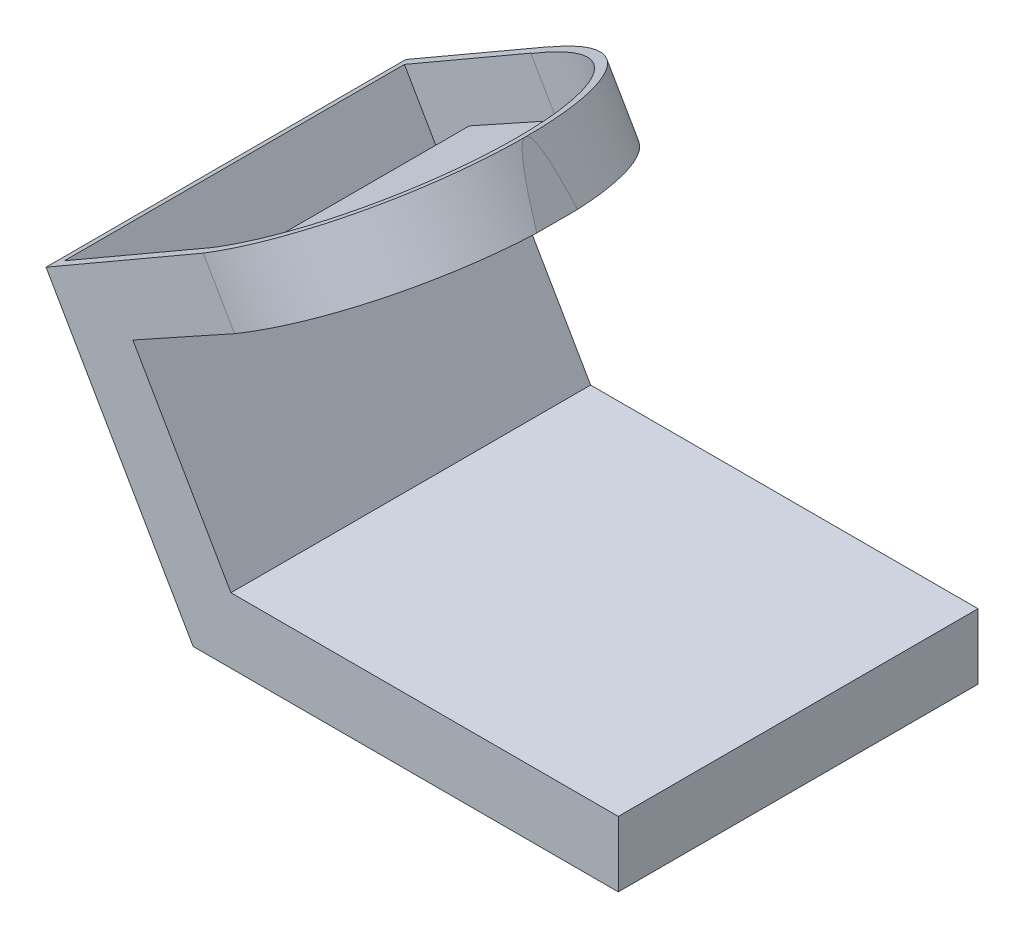
from build123d import *

# Parameters (mm, degrees)
SALIENTE_EXTRUIR1_DEPTH = 110
CORTAR_EXTRUIR9_DEPTH   = 55
VACIADO3_START          = 3.186974639
VACIADO3_DEPTH          = 103.813025361
VACIADO3_START_2        = 3
VACIADO3_2_DEPTH        = 0.273585229
VACIADO3_START_3        = -90
VACIADO3_3_DEPTH        = 16.944212752
CROQUIS7_R              = 9.5
CORTAR_EXTRUIR10_DEPTH  = 55


with BuildPart() as part:
    # Croquis1 → Saliente-Extruir1 (new body)
    with BuildSketch(Plane.XY):
        Polygon((0, 0), (130, 0), (130, 20), (11.547005384, 20), (-18.439456819, 71.938076074), (56.490425623, 113.447420953), (46.798692801, 130.942286341), (-45, 77.942286341), align=None)
    extrude(amount=SALIENTE_EXTRUIR1_DEPTH)

    # Croquis6 → Cortar-Extruir9 (cut, symmetric)
    with BuildSketch(Plane(origin=(-45, 77.942286341, 0), x_dir=(0.8660254037844362, 0.5000000000000044, 0), z_dir=(-0.5000000000000043, 0.866025403784436, 0))):
        with BuildLine():
            Line((51, -110.186974639), (51, -125.465118776))
            Line((51, -125.465118776), (118.324922333, -125.465118776))
            Line((118.324922333, -125.465118776), (118.324922333, 14.437296871))
            Line((118.324922333, 14.437296871), (51, 14.437296871))
            Line((51, 14.437296871), (51, -0.186974639))
            ThreePointArc((51, -0.186974639), (106, -55.186974639), (51, -110.186974639))
        make_face()
    extrude(amount=CORTAR_EXTRUIR9_DEPTH, both=True, mode=Mode.SUBTRACT)

    # Vaciado3: read off the stored shape, not the designer's step
    # Vaciado3 outline → Vaciado3 (cut)
    with BuildSketch(Plane.XY.offset(VACIADO3_START)):
        Polygon((52.412435892, 114.617890838), (44.200209183, 129.442051124), (-42.401923789, 79.442286341), (1.732050808, 3), (127, 3), (127, 17), (9.814954576, 17), (-22.564333351, 73.082571803), align=None)
    extrude(amount=VACIADO3_DEPTH, mode=Mode.SUBTRACT)

    # Vaciado3 2 outline → Vaciado3 2 (cut)
    with BuildSketch(Plane.XY.offset(VACIADO3_START_2)):
        Polygon((4.556960249, 88.107113321), (-3.430780618, 101.942286341), (-42.401923789, 79.442286341), (1.732050808, 3), (127, 3), (127, 17), (9.814954576, 17), (-22.564333351, 73.082571803), align=None)
    extrude(amount=VACIADO3_2_DEPTH, mode=Mode.SUBTRACT)

    # Vaciado3 3 outline → Vaciado3 3 (add)
    with BuildSketch(Plane(origin=(0, 0, 0), x_dir=(0.8660254037844362, 0.5000000000000042, 0), z_dir=(0.5000000000000042, -0.8660254037844363, 0)).offset(VACIADO3_START_3)):
        with BuildLine():
            ThreePointArc((68.916472868, 3.186974639), (89.973499173, 16.3789038), (103.075739879, 37.491853388))
            Line((103.075739879, 37.491853388), (103.000470437, 55.186974639))
            Line((103.000470437, 55.186974639), (102.999529567, 54.965785108))
            ThreePointArc((102.999529567, 54.965785108), (87.691266975, 18.339302693), (51, 3.186974639))
            Line((51, 3.186974639), (68.916472868, 3.186974639))
        make_face()
        with BuildLine():
            Line((103.000470437, 55.186974639), (103.075739879, 72.882095888))
            ThreePointArc((103.075739879, 72.882095888), (90.172508138, 93.794157987), (69.450214169, 107))
            Line((69.450214169, 107), (55.405723879, 107))
            ThreePointArc((55.405723879, 107), (89.220642789, 90.445767369), (102.999529567, 55.408164169))
            Line((102.999529567, 55.408164169), (103.000470437, 55.186974639))
        make_face()
        with BuildLine():
            Line((48, 3.186974639), (51, 3.186974639))
            ThreePointArc((51, 3.186974639), (49.499375014, 3.208631796), (48, 3.273585229))
            Line((48, 3.273585229), (48, 3.186974639))
        make_face()
    extrude(amount=VACIADO3_3_DEPTH)

    # Croquis7 → Cortar-Extruir10 (cut, symmetric)
    with BuildSketch(Plane(origin=(-36.277542983, 65.485784921, 0), x_dir=(0.874743269355894, 0.4845866410834722, 0), z_dir=(-0.4845866410834722, 0.874743269355894, 0))):
        with Locations(Location((49.406343615, -55.095, 0), (0, 0, 180))):
            Circle(CROQUIS7_R)
    extrude(amount=CORTAR_EXTRUIR10_DEPTH, both=True, mode=Mode.SUBTRACT)


solid = part.part
